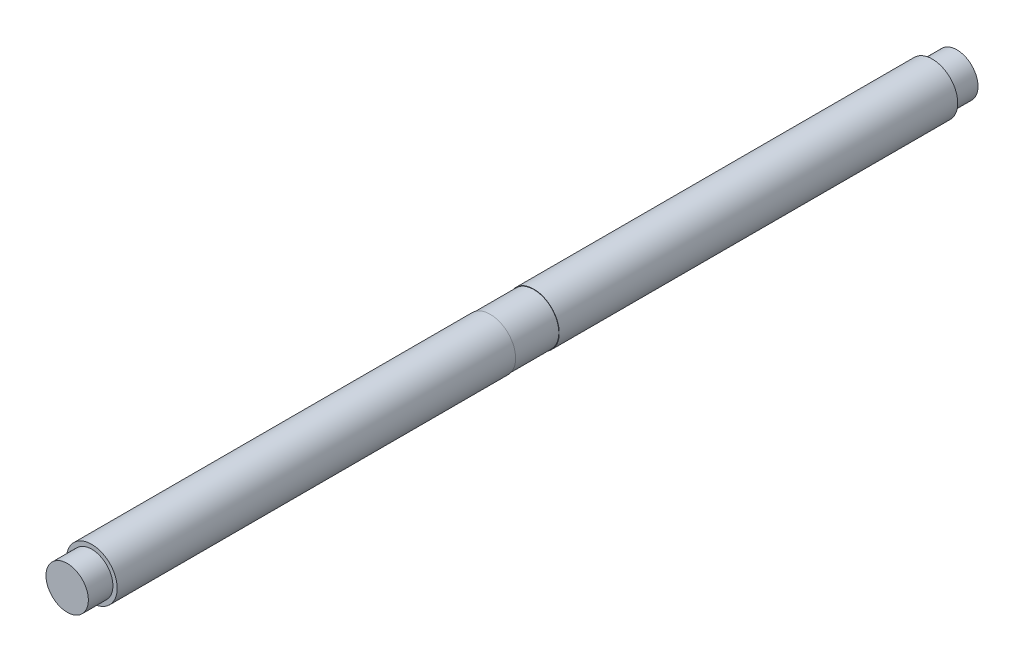
from build123d import *

# Parameters (mm, degrees)
SKETCH_1_R          = 6
EXTRUDE_1_DEPTH     = 105
CUT_EXTRUDE_START   = -5.8
SKETCH_2_R          = 6
SKETCH_2_R_2        = 5
CUT_EXTRUDE_1_DEPTH = 5.8
SKETCH_3_R          = 6
SKETCH_3_R_2        = 5.9
CUT_EXTRUDE_2_DEPTH = 5.15


with BuildPart() as part:
    # ｽｹｯﾁ1 → ﾎﾞｽ - 押し出し1 (new, symmetric)
    with BuildSketch(Plane.XY):
        Circle(SKETCH_1_R)
    extrude(amount=EXTRUDE_1_DEPTH, both=True)

    # ｽｹｯﾁ2 → ｶｯﾄ - 押し出し1 (cut)
    with BuildSketch(Plane(origin=(0, 0, -105), x_dir=(-1, 0, 0), z_dir=(0, 0, -1)).offset(CUT_EXTRUDE_START)):
        Circle(SKETCH_2_R)
        Circle(SKETCH_2_R_2, mode=Mode.SUBTRACT)
    cut_extrude_1 = extrude(amount=CUT_EXTRUDE_1_DEPTH, mode=Mode.SUBTRACT)

    # ﾐﾗｰ1: ｶｯﾄ - 押し出し1 across plane
    add(cut_extrude_1.mirror(Plane.XY), mode=Mode.SUBTRACT)

    # ｽｹｯﾁ3 → ｶｯﾄ - 押し出し2 (cut, symmetric)
    with BuildSketch(Plane.XY):
        Circle(SKETCH_3_R)
        Circle(SKETCH_3_R_2, mode=Mode.SUBTRACT)
    extrude(amount=CUT_EXTRUDE_2_DEPTH, both=True, mode=Mode.SUBTRACT)


solid = part.part
